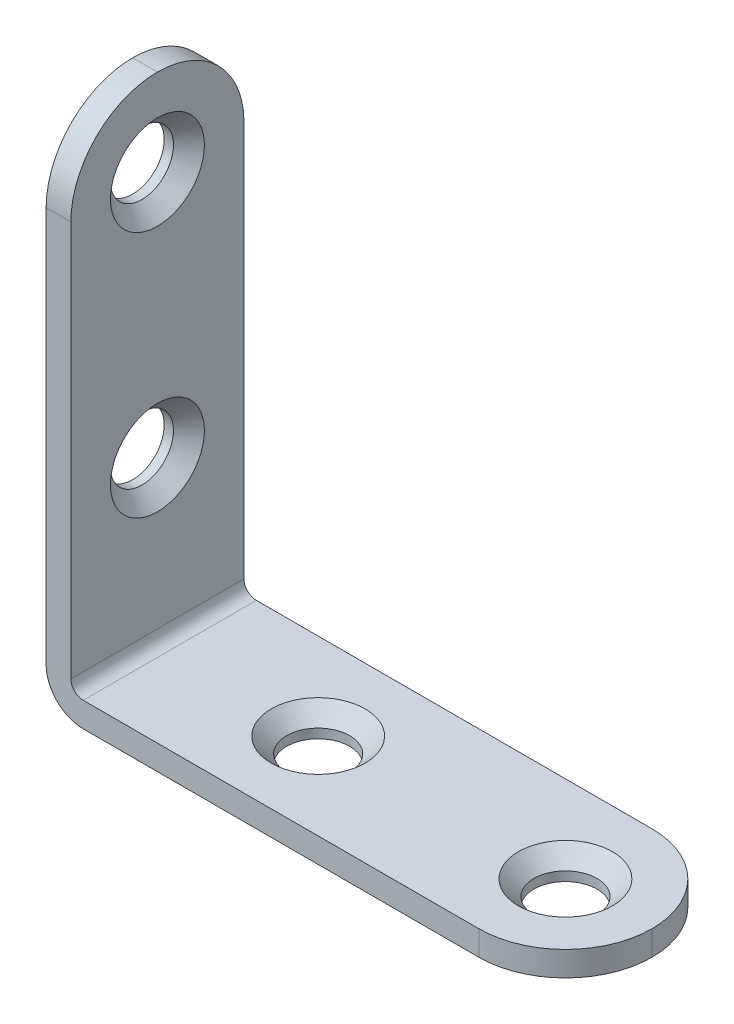
from build123d import *

# Parameters (mm, degrees)
BOSS_EXTRU_1_DEPTH                         = 7
CONG_1_R                                   = 7
FRAISAGE_POUR_VIS_T_TE_FRAIS_E_6_2_COUNT   = 2
FRAISAGE_POUR_VIS_T_TE_FRAIS_E_6_2_PITCH   = 20
FRAISAGE_POUR_VIS_T_TE_FRAIS_E_6_3_A_COUNT = 2
FRAISAGE_POUR_VIS_T_TE_FRAIS_E_6_3_A_PITCH = 20


with BuildPart() as part:
    # Esquisse1 → Boss.-Extru.1 (new, symmetric)
    with BuildSketch(Plane.XY):
        with BuildLine():
            Line((0, 3), (0, 42))
            Line((0, 42), (2, 42))
            Line((2, 42), (2, 3))
            ThreePointArc((2, 3), (2.292893219, 2.292893219), (3, 2))
            Line((3, 2), (42, 2))
            Line((42, 2), (42, 0))
            Line((42, 0), (3, 0))
            ThreePointArc((3, 0), (0.878679656, 0.878679656), (0, 3))
        make_face()
    extrude(amount=BOSS_EXTRU_1_DEPTH, both=True)

    # Congé1
    cong_1_edges = [part.edges().sort_by_distance(p)[0] for p in [
        (1, 42, -7),
        (1, 42, 7),
        (42, 1, -7),
        (42, 1, 7),
    ]]
    fillet(cong_1_edges, radius=CONG_1_R - 0.0001)  # a hair under: the kernel refuses the full size

    # Esquisse2 → Fraisage pour vis _ t_te frais_e _ 6 pan (revolve, cut)
    with BuildSketch(Plane(origin=(35, 2, 0), x_dir=(0, 0, 1), z_dir=(1, 0, 0))):
        Polygon((0, 0), (0, 2), (2.55, 2), (2.55, 1.25), (3.8, 0), align=None)
    fraisage_pour_vis_t_te_frais_e_6_pan = revolve(axis=Axis((35, 8.35, 0), (0, -1, 0)), mode=Mode.SUBTRACT)

    # Fraisage pour vis _ t_te frais_e _ 6 2: Fraisage pour vis _ t_te frais_e _ 6 pan ×2
    with Locations(*[(-i * FRAISAGE_POUR_VIS_T_TE_FRAIS_E_6_2_PITCH, 0, 0) for i in range(1, FRAISAGE_POUR_VIS_T_TE_FRAIS_E_6_2_COUNT)]):
        add(fraisage_pour_vis_t_te_frais_e_6_pan, mode=Mode.SUBTRACT)

    # Esquisse4 → Fraisage pour vis _ t_te frais_e _ 6 3 (revolve, cut)
    with BuildSketch(Plane(origin=(2, 35, 0), x_dir=(0, 0, -1), z_dir=(0, 1, 0))):
        Polygon((0, 0), (0, 2), (2.55, 2), (2.55, 1.25), (3.8, 0), align=None)
    fraisage_pour_vis_t_te_frais_e_6_3 = revolve(axis=Axis((8.35, 35, 0), (-1, 0, 0)), mode=Mode.SUBTRACT)

    # Fraisage pour vis _ t_te frais_e _ 6 3 a: Fraisage pour vis _ t_te frais_e _ 6 3 ×2
    with Locations(*[(0, -i * FRAISAGE_POUR_VIS_T_TE_FRAIS_E_6_3_A_PITCH, 0) for i in range(1, FRAISAGE_POUR_VIS_T_TE_FRAIS_E_6_3_A_COUNT)]):
        add(fraisage_pour_vis_t_te_frais_e_6_3, mode=Mode.SUBTRACT)


solid = part.part
